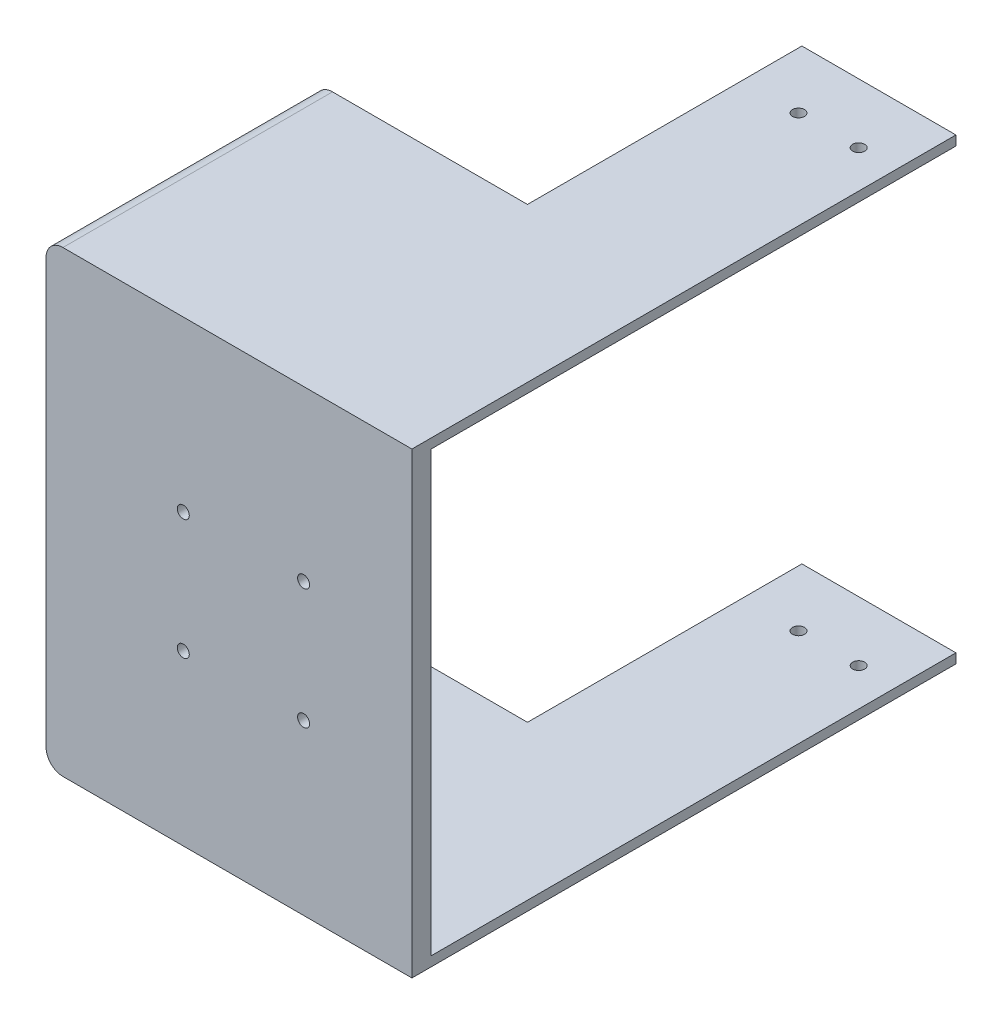
from build123d import *

# Parameters (mm, degrees)
SM_BASE_FLANGE_1_DEPTH = 113
EXTRUDE_1_DEPTH        = 4
HOLE_WIZARD_M3_1_D     = 2.5
SKETCH_11_W            = 71.5874944
SKETCH_11_H            = 95.16
CUT_EXTRUDE_1_DEPTH    = 44
HOLE_WIZARD_M3_2_D     = 2.5


# Sheet-metal steps are written as plain solids
with BuildPart() as part:
    # Sketch 2 → 基体-法兰1 (new body)
    with BuildSketch(Plane.XY):
        with BuildLine():
            Line((74, 45.58), (1.5, 45.58))
            ThreePointArc((1.5, 45.58), (0.439339828, 45.140660172), (0, 44.08))
            Line((0, 44.08), (0, -44.08))
            ThreePointArc((0, -44.08), (0.439339828, -45.140660172), (1.5, -45.58))
            Line((1.5, -45.58), (74, -45.58))
            Line((74, -45.58), (74, -47.58))
            Line((74, -47.58), (1.5, -47.58))
            ThreePointArc((1.5, -47.58), (-0.974873734, -46.554873734), (-2, -44.08))
            Line((-2, -44.08), (-2, 44.08))
            ThreePointArc((-2, 44.08), (-0.974873734, 46.554873734), (1.5, 47.58))
            Line((1.5, 47.58), (74, 47.58))
            Line((74, 47.58), (74, 45.58))
        make_face()
    extrude(amount=-SM_BASE_FLANGE_1_DEPTH)

    # 草图7 → 凸台-拉伸1 (add)
    with BuildSketch(Plane.XY):
        with BuildLine():
            Line((74, 45.58), (1.5, 45.58))
            ThreePointArc((1.5, 45.58), (0.439339828, 45.140660172), (0, 44.08))
            Line((0, 44.08), (0, -44.08))
            ThreePointArc((0, -44.08), (0.439339828, -45.140660172), (1.5, -45.58))
            Line((1.5, -45.58), (74, -45.58))
            Line((74, -45.58), (74, 45.58))
        make_face()
    extrude(amount=-EXTRUDE_1_DEPTH)

    # M3 螺纹孔1 (through all)
    with Locations(Plane(origin=(0, 47.58, 0), x_dir=(1, 0, 0), z_dir=(0, 1, 0))):
        with Locations((53.7, 100.6), (66.2, 100.6)):
            Hole(HOLE_WIZARD_M3_1_D / 2)

    # 草图11 → 切除-拉伸1 (cut)
    with BuildSketch(Plane.ZY.offset(2)):
        with Locations((-91.7937472, 0)):
            Rectangle(SKETCH_11_W, SKETCH_11_H)
    extrude(amount=-CUT_EXTRUDE_1_DEPTH, mode=Mode.SUBTRACT)

    # M3 螺纹孔2 (through all)
    with Locations(Plane(origin=(0, 0, -4), x_dir=(-1, 0, 0), z_dir=(0, 0, -1))):
        with Locations((-51.5, 12.5), (-26.5, 12.5), (-26.5, -12.5), (-51.5, -12.5)):
            Hole(HOLE_WIZARD_M3_2_D / 2)


solid = part.part
